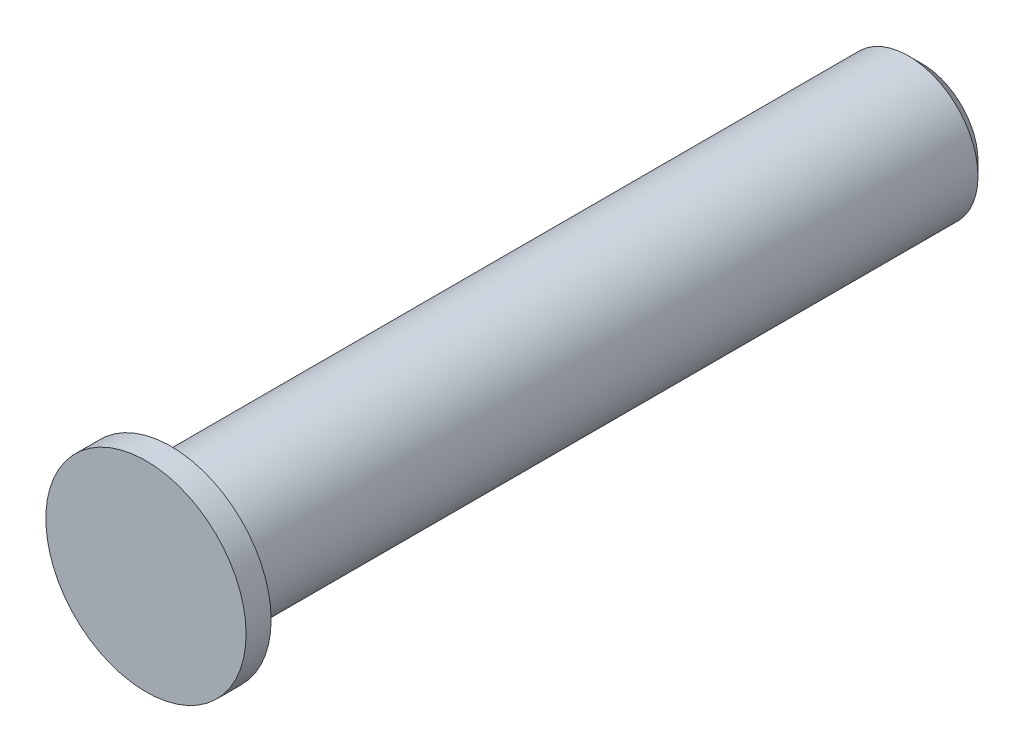
from build123d import *

# Parameters (mm, degrees)
SKETCH_1_R      = 6
EXTRUDE_1_DEPTH = 40
SKETCH_1_4_R    = 6
EXTRUDE_3_DEPTH = 60
SKETCH_2_R      = 8
EXTRUDE_4_DEPTH = 2


# Read off the part's stored shape, not the designer's step: 7/16-14 机械螺纹 螺柱1
with BuildPart() as part:
    # 草图1 → 凸台-拉伸1 (new body)
    with BuildSketch(Plane.XY):
        with Locations((-5, 28)):
            Circle(SKETCH_1_R)
    extrude(amount=EXTRUDE_1_DEPTH)

    # 草图1<4> → 凸台-拉伸3 (add)
    with BuildSketch(Plane.XY):
        with Locations((-5, 28)):
            Circle(SKETCH_1_4_R)
    extrude(amount=EXTRUDE_3_DEPTH)

    # 草图2 → 凸台-拉伸4 (add)
    with BuildSketch(Plane.XY.offset(60)):
        with Locations((-5, 28)):
            Circle(SKETCH_2_R)
    extrude(amount=EXTRUDE_4_DEPTH)

    # 7/16-14 机械螺纹 螺柱1 outline → 7/16-14 机械螺纹 螺柱1 (revolve, cut)
    with BuildSketch(Plane(origin=(-5, 28, 0), x_dir=(1, 0, 0), z_dir=(0, -1, 0))):
        Polygon((4.47675, 0), (6, 0), (6, 60), (5.55625, 60), (5.55625, 1.0795), align=None)
    revolve(axis=Axis((-5, 28, 0), (0, 0, 1)), mode=Mode.SUBTRACT)


solid = part.part
